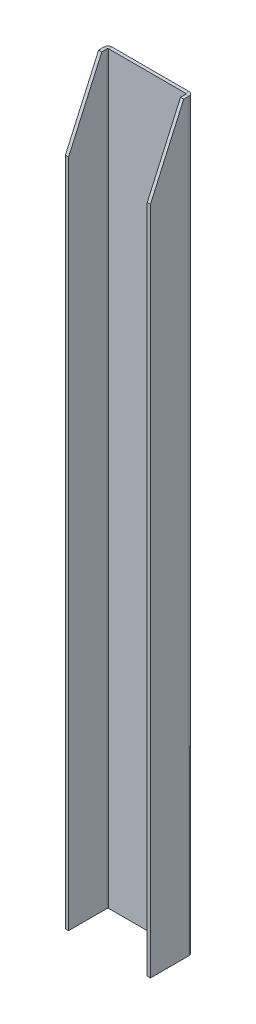
from build123d import *

# Parameters (mm, degrees)
BASE_FLANGE1_DEPTH             = 700
CUT_EXTRUDE1_REACH             = 704.282
CUT_EXTRUDE1_DIRECTION_2_REACH = 704.282


# Sheet-metal steps are written as plain solids
with BuildPart() as part:
    # Sketch1 → Base-Flange1 (new body)
    with BuildSketch(Plane(origin=(0, 0, 0), x_dir=(1, 0, 0), z_dir=(0, 1, 0))):
        with BuildLine():
            Line((-40, -40), (-40, -3.7366))
            ThreePointArc((-40, -3.7366), (-38.905575199, -1.094424801), (-36.2634, 0))
            Line((-36.2634, 0), (36.2634, 0))
            ThreePointArc((36.2634, 0), (38.905575199, -1.094424801), (40, -3.7366))
            Line((40, -3.7366), (40, -40))
            Line((40, -40), (37, -40))
            Line((37, -40), (37, -3.7366))
            ThreePointArc((37, -3.7366), (36.784254855, -3.215745145), (36.2634, -3))
            Line((36.2634, -3), (-36.2634, -3))
            ThreePointArc((-36.2634, -3), (-36.784254855, -3.215745145), (-37, -3.7366))
            Line((-37, -3.7366), (-37, -40))
            Line((-37, -40), (-40, -40))
        make_face()
    extrude(amount=BASE_FLANGE1_DEPTH)

    # Cut-Extrude1: up to this face of the body (flat: up to its plane)
    cut_extrude1_end = Plane(part.part.faces().sort_by_distance((-40, 350, 21.8683))[0])
    # Sketch6 → Cut-Extrude1 (cut, up to the picked face)
    with BuildSketch(Plane(origin=(0, 0, 0), x_dir=(0, 0, -1), z_dir=(1, 0, 0)), mode=Mode.PRIVATE) as cut_extrude1_sk1:
        Polygon((-8.7366, 700), (-40, 630), (-40, 700), align=None)
    cut_extrude1_tool1 = split(extrude(cut_extrude1_sk1.sketch, amount=-CUT_EXTRUDE1_REACH, mode=Mode.PRIVATE), bisect_by=cut_extrude1_end, keep=Keep.BOTH, mode=Mode.PRIVATE)
    add(cut_extrude1_tool1.solids().sort_by(Axis((0, 676.666667, 29.578867), (-1, 0, 0)))[0], mode=Mode.SUBTRACT)

    # Cut-Extrude1 direction 2: up to this face of the body (flat: up to its plane)
    cut_extrude1_direction_2_end = Plane(part.part.faces().sort_by_distance((40, 350, 21.8683))[0])
    # Sketch6 → Cut-Extrude1 direction 2 (cut, up to the picked face)
    with BuildSketch(Plane(origin=(0, 0, 0), x_dir=(0, 0, -1), z_dir=(1, 0, 0)), mode=Mode.PRIVATE) as cut_extrude1_direction_2_sk1:
        Polygon((-8.7366, 700), (-40, 630), (-40, 700), align=None)
    cut_extrude1_direction_2_tool1 = split(extrude(cut_extrude1_direction_2_sk1.sketch, amount=CUT_EXTRUDE1_DIRECTION_2_REACH, mode=Mode.PRIVATE), bisect_by=cut_extrude1_direction_2_end, keep=Keep.BOTH, mode=Mode.PRIVATE)
    add(cut_extrude1_direction_2_tool1.solids().sort_by(Axis((0, 676.666667, 29.578867), (1, 0, 0)))[0], mode=Mode.SUBTRACT)


solid = part.part
